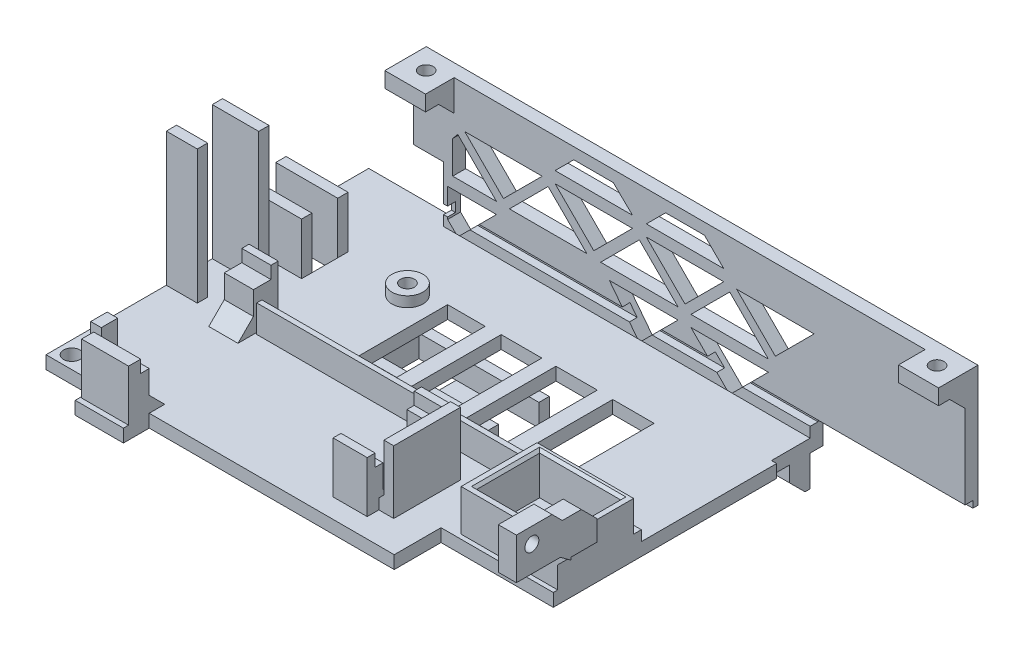
from build123d import *

# Parameters (mm, degrees)
SKETCH1_W            = 100
SKETCH1_H            = 50
BOSS_EXTRUDE1_DEPTH  = 2.5
SKETCH2_W            = 12
SKETCH2_H            = 2
SKETCH2_W_2          = 14
SKETCH2_H_2          = 2.5
BOSS_EXTRUDE2_DEPTH  = 10
SKETCH3_W            = 2
SKETCH3_H            = 15
BOSS_EXTRUDE3_DEPTH  = 9
SKETCH4_W            = 2
SKETCH4_H            = 15
BOSS_EXTRUDE4_DEPTH  = 6
SKETCH5_W            = 70.5
SKETCH5_H            = 2.5
SKETCH5_W_2          = 70.488099932
BOSS_EXTRUDE5_DEPTH  = 2
SKETCH6_W            = 70.5
SKETCH6_H            = 1
BOSS_EXTRUDE6_DEPTH  = 1.8
SKETCH7_W            = 70.488099932
SKETCH7_H            = 2.5
SKETCH7_W_2          = 70.5
BOSS_EXTRUDE7_DEPTH  = 1.5
SKETCH8_R            = 3
BOSS_EXTRUDE8_DEPTH  = 2
SKETCH9_R            = 1.35
CUT_EXTRUDE1_DEPTH   = 6.5
SKETCH10_W           = 100
SKETCH10_H           = 17.3188113
BOSS_EXTRUDE10_DEPTH = 2.5
SKETCH11_W           = 18.7
SKETCH11_H           = 16.2
SKETCH11_W_2         = 15.7
SKETCH11_H_2         = 12.2
BOSS_EXTRUDE11_DEPTH = 8
CHAMFER1_SIZE        = 0.5
SKETCH13_W           = 6
SKETCH13_H           = 2
SKETCH13_W_2         = 9
BOSS_EXTRUDE12_DEPTH = 12
SKETCH14_W           = 2
SKETCH14_H           = 2.795142651
BOSS_EXTRUDE13_DEPTH = 9
SKETCH16_W           = 9.1041359
SKETCH16_H           = 4
SKETCH16_W_2         = 5.652312223
SKETCH16_H_2         = 4.80234046
SKETCH16_W_3         = 20.476383994
SKETCH16_H_3         = 3.061420156
SKETCH16_H_4         = 2.810484078
BOSS_EXTRUDE14_DEPTH = 7.5
SKETCH17_W           = 9.1041359
SKETCH17_H           = 2.345250113
SKETCH17_W_2         = 5.652312223
SKETCH17_H_2         = 1.406462041
SKETCH17_W_3         = 20.476383994
SKETCH17_H_3         = 1.405242039
SKETCH17_H_4         = 1.530710078
BOSS_EXTRUDE15_DEPTH = 1.2
SKETCH18_W           = 20.47039794
SKETCH18_H           = 2.810451887
SKETCH18_W_2         = 20.476383994
SKETCH18_H_2         = 3.061420156
SKETCH18_W_3         = 5.652312223
SKETCH18_H_3         = 2.336151346
SKETCH18_W_4         = 9.1041359
SKETCH18_H_4         = 4
BOSS_EXTRUDE16_DEPTH = 1.2
SKETCH19_W           = 1.900158485
SKETCH19_H           = 12.912440612
BOSS_EXTRUDE17_DEPTH = 12.2
CHAMFER2_SIZE        = 3
SKETCH20_W           = 10.479569139
SKETCH20_H           = 7.910578843
SKETCH20_W_2         = 34.648374457
SKETCH20_H_2         = 2.863391661
SKETCH20_W_3         = 11.37665543
SKETCH20_H_3         = 2.773813667
SKETCH20_H_4         = 0.85940565
SKETCH20_W_4         = 11.835543615
SKETCH20_H_5         = 59.441475781
CUT_EXTRUDE2_DEPTH   = 12.2
SKETCH21_R           = 1.6
CUT_EXTRUDE3_DEPTH   = 9
SKETCH22_W           = 8
SKETCH22_H           = 4
SKETCH22_W_2         = 6
BOSS_EXTRUDE18_DEPTH = 6
CHAMFER3_SIZE        = 3
SKETCH23_R           = 1.35
CUT_EXTRUDE6_DEPTH   = 4
BOSS_EXTRUDE20_START = -1.5
SKETCH25_W           = 15.573275737
SKETCH25_H           = 7.991483458
BOSS_EXTRUDE20_DEPTH = 3.5
SKETCH26_W           = 3.5
SKETCH26_H           = 5.673275737
CUT_EXTRUDE7_DEPTH   = 2
SKETCH27_W           = 16.502676769
SKETCH27_H           = 20.487843295
CUT_EXTRUDE8_DEPTH   = 35
SKETCH28_R           = 1.35
CUT_EXTRUDE9_DEPTH   = 35
CHAMFER4_SIZE        = 3
CHAMFER5_SIZE        = 3
BOSS_EXTRUDE21_REACH = 100.643
SKETCH30_W           = 47.446580051
SKETCH30_H           = 1.27308646
CUT_EXTRUDE10_DEPTH  = 11
SKETCH31_W           = 10
SKETCH31_H           = 2.5
BOSS_EXTRUDE22_DEPTH = 29
SKETCH32_W           = 30.5
SKETCH32_H           = 26
BOSS_EXTRUDE23_DEPTH = 2.5
SKETCH33_W           = 5.852689777
SKETCH33_H           = 15.157351146
SKETCH33_W_2         = 70.5
SKETCH33_H_2         = 20.7
BOSS_EXTRUDE24_DEPTH = 2.5
SKETCH35_W           = 7.894138159
SKETCH35_H           = 5.531718611
SKETCH35_W_2         = 7.679440434
SKETCH35_H_2         = 5.136534224
SKETCH35_W_3         = 7.73858996
BOSS_EXTRUDE25_DEPTH = 3
SKETCH36_R           = 1.35
CUT_EXTRUDE12_DEPTH  = 3
SKETCH37_W           = 5
SKETCH37_H           = 4.587019784
CUT_EXTRUDE13_DEPTH  = 12
SKETCH38_W           = 7.273722909
SKETCH38_H           = 18.053706391
SKETCH38_W_2         = 7.874305534
SKETCH38_H_2         = 18.214504952
SKETCH38_W_3         = 8.00776834
SKETCH38_W_4         = 8.007768341
SKETCH38_H_3         = 18.134105671
CUT_EXTRUDE14_DEPTH  = 17
SKETCH39_W           = 22.888600216
SKETCH39_H           = 1.8
CUT_EXTRUDE15_DEPTH  = 5
SKETCH40_W           = 30
SKETCH40_H           = 5
CUT_EXTRUDE16_DEPTH  = 10
SKETCH41_W           = 31.576307645
SKETCH41_H           = 1.8
CUT_EXTRUDE17_DEPTH  = 1.5
SKETCH42_W           = 71.988099932
SKETCH42_H           = 1.5
CUT_EXTRUDE18_DEPTH  = 12
SKETCH43_W           = 6.603546664
SKETCH43_H           = 1.530710078
SKETCH43_H_2         = 1.405242039
SKETCH43_W_2         = 9.1041359
SKETCH43_H_3         = 3
SKETCH43_W_3         = 5.652312223
SKETCH43_H_4         = 3.395878419
CUT_EXTRUDE19_DEPTH  = 12
SKETCH44_W           = 9.1041359
SKETCH44_H           = 1.654749887
CUT_EXTRUDE20_DEPTH  = 22
SKETCH45_W           = 2.045887398
SKETCH45_H           = 3.1811887
BOSS_EXTRUDE26_DEPTH = 9.9
CHAMFER6_SIZE        = 1.5
CHAMFER7_SIZE        = 3
SKETCH46_W           = 14
SKETCH46_H           = 10
CUT_EXTRUDE21_DEPTH  = 5
CUT_EXTRUDE22_DEPTH  = 2.5
SKETCH48_W           = 25
SKETCH48_H           = 2
BOSS_EXTRUDE27_DEPTH = 4.3
SKETCH50_W           = 4.781011395
SKETCH50_H           = 11.6
BOSS_EXTRUDE29_DEPTH = 1.7
SKETCH51_W           = 1.951933906
SKETCH51_H           = 11.6
BOSS_EXTRUDE30_DEPTH = 4.3
SKETCH52_W           = 11.630729643
SKETCH52_H           = 8.420698883
CUT_EXTRUDE23_DEPTH  = 10


with BuildPart() as part:
    # Sketch1 → Boss-Extrude1 (new body)
    with BuildSketch(Plane(origin=(0, 0, 0), x_dir=(1, 0, 0), z_dir=(0, 1, 0))):
        with Locations((-13.167938931, 6.679389313)):
            Rectangle(SKETCH1_W, SKETCH1_H)
    extrude(amount=BOSS_EXTRUDE1_DEPTH)

    # Sketch2 → Boss-Extrude2 (add)
    with BuildSketch(Plane(origin=(0, 2.5, 0), x_dir=(1, 0, 0), z_dir=(0, 1, 0))):
        with Locations((-57.167938931, 14.679389313)):
            Rectangle(SKETCH2_W, SKETCH2_H)
        with Locations((-56.167938931, 27.929389313)):
            Rectangle(SKETCH2_W_2, SKETCH2_H_2)
        with Locations((-57.167938931, 7.679389313)):
            Rectangle(SKETCH2_W, SKETCH2_H)
    extrude(amount=BOSS_EXTRUDE2_DEPTH)

    # Sketch3 → Boss-Extrude3 (add)
    with BuildSketch(Plane.ZY.offset(63.167938931)):
        with Locations((-2.379389313, 8.674746325)):
            Rectangle(SKETCH3_W, SKETCH3_H)
    extrude(amount=-BOSS_EXTRUDE3_DEPTH)

    # Sketch4 → Boss-Extrude4 (add)
    with BuildSketch(Plane.ZY.offset(63.167938931)):
        with Locations((6.520610687, 8.856918224)):
            Rectangle(SKETCH4_W, SKETCH4_H)
    extrude(amount=-BOSS_EXTRUDE4_DEPTH)

    # Sketch5 → Boss-Extrude5 (add)
    with BuildSketch(Plane(origin=(0, 2.5, 0), x_dir=(1, 0, 0), z_dir=(0, 1, 0))):
        with Locations((-10.917938931, 30.429389313)):
            Rectangle(SKETCH5_W, SKETCH5_H)
        with Locations((-10.911988897, -5.770610687)):
            Rectangle(SKETCH5_W_2, SKETCH5_H)
    extrude(amount=BOSS_EXTRUDE5_DEPTH)

    # Sketch6 → Boss-Extrude6 (add)
    with BuildSketch(Plane(origin=(0, 4.5, 0), x_dir=(1, 0, 0), z_dir=(0, 1, 0))):
        with Locations((-10.917938931, 31.179389313)):
            Rectangle(SKETCH6_W, SKETCH6_H)
        with Locations((-10.917938931, -6.520610687)):
            Rectangle(SKETCH6_W, SKETCH6_H)
    extrude(amount=BOSS_EXTRUDE6_DEPTH)

    # Sketch7 → Boss-Extrude7 (add)
    with BuildSketch(Plane(origin=(0, 6.3, 0), x_dir=(1, 0, 0), z_dir=(0, 1, 0))):
        with Locations((-10.911988897, -5.770610687)):
            Rectangle(SKETCH7_W, SKETCH7_H)
        with Locations((-10.917938931, 30.429389313)):
            Rectangle(SKETCH7_W_2, SKETCH7_H)
    extrude(amount=BOSS_EXTRUDE7_DEPTH)

    # Sketch8 → Boss-Extrude8 (add)
    with BuildSketch(Plane(origin=(0, 2.5, 0), x_dir=(1, 0, 0), z_dir=(0, 1, 0))):
        with Locations(Location((-38.167938931, 14.179389313, 0), (0, 0, 270))):
            Circle(SKETCH8_R)
    extrude(amount=BOSS_EXTRUDE8_DEPTH)

    # Sketch9 → Cut-Extrude1 (cut)
    with BuildSketch(Plane(origin=(0, 4.5, 0), x_dir=(1, 0, 0), z_dir=(0, 1, 0))):
        with Locations(Location((-38.167938931, 14.179389313, 0), (0, 0, 270))):
            Circle(SKETCH9_R)
    extrude(amount=-CUT_EXTRUDE1_DEPTH, mode=Mode.SUBTRACT)

    # Sketch10 → Boss-Extrude10 (add)
    with BuildSketch(Plane(origin=(0, 2.5, 0), x_dir=(1, 0, 0), z_dir=(0, 1, 0))):
        with Locations((-13.167938931, -26.980016337)):
            Rectangle(SKETCH10_W, SKETCH10_H)
    extrude(amount=-BOSS_EXTRUDE10_DEPTH)

    # Sketch11 → Boss-Extrude11 (add)
    with BuildSketch(Plane(origin=(0, 2.5, 0), x_dir=(1, 0, 0), z_dir=(0, 1, 0))):
        with Locations((16.482061069, -12.620610687)):
            Rectangle(SKETCH11_W, SKETCH11_H)
        with Locations((16.482061069, -13.120610687)):
            Rectangle(SKETCH11_W_2, SKETCH11_H_2, mode=Mode.SUBTRACT)
    extrude(amount=BOSS_EXTRUDE11_DEPTH)

    # Chamfer1
    chamfer1_edges = [part.edges().sort_by_distance(p)[0] for p in [
        (8.632061069, 10.5, 13.120610687),
        (16.482061069, 10.5, 19.220610687),
        (24.332061069, 10.5, 13.120610687),
        (16.482061069, 10.5, 7.020610687),
    ]]
    chamfer(chamfer1_edges, length=CHAMFER1_SIZE)

    # Sketch13 → Boss-Extrude12 (add)
    with BuildSketch(Plane(origin=(0, 16.356918224, 0), x_dir=(1, 0, 0), z_dir=(0, 1, 0))):
        with Locations((-60.167938931, -6.520610687)):
            Rectangle(SKETCH13_W, SKETCH13_H)
        with Locations((-58.667938931, 2.379389313)):
            Rectangle(SKETCH13_W_2, SKETCH13_H)
    extrude(amount=BOSS_EXTRUDE12_DEPTH)


with BuildPart() as boss_extrude12_piece_1:
    # of the separate pieces the step leaves, piece 1, a body of its own (boss_extrude12_pieces)
    add(part.part.solids().sort_by_distance((8.132061069, 10.5, 19.720610687))[0])



with BuildPart() as boss_extrude12_piece_2:
    # of the separate pieces the step leaves, piece 2, a body of its own (boss_extrude12_pieces)
    add(part.part.solids().sort_by_distance((-63.167938931, 16.356918224, -3.379389313))[0])


with BuildPart() as boss_extrude12_piece_1_1:
    add(boss_extrude12_piece_1.part)

    add(boss_extrude12_piece_2.part)  # Boss-Extrude13 merges Boss-Extrude12 piece 2
    # Sketch14 → Boss-Extrude13 (add)
    with BuildSketch(Plane.ZY.offset(63.167938931)):
        with Locations((-2.379389313, 16.557730514)):
            Rectangle(SKETCH14_W, SKETCH14_H)
    extrude(amount=-BOSS_EXTRUDE13_DEPTH)

    # Sketch16 → Boss-Extrude14 (add)
    with BuildSketch(Plane(origin=(0, 2.5, 0), x_dir=(1, 0, 0), z_dir=(0, 1, 0))):
        with Locations((-47.90773498, -32.639421987)):
            Rectangle(SKETCH16_W, SKETCH16_H)
        with Locations((-49.316086437, -4.921780917)):
            Rectangle(SKETCH16_W_2, SKETCH16_H_2)
        with Locations((-15.148804269, -25.341936571)):
            Rectangle(SKETCH16_W_3, SKETCH16_H_3)
        with Locations((-15.148804269, -11.164048144)):
            Rectangle(SKETCH16_W_3, SKETCH16_H_4)
    extrude(amount=BOSS_EXTRUDE14_DEPTH)

    # Sketch17 → Boss-Extrude15 (add)
    with BuildSketch(Plane(origin=(0, 10, 0), x_dir=(1, 0, 0), z_dir=(0, 1, 0))):
        with Locations((-47.90773498, -33.46679693)):
            Rectangle(SKETCH17_W, SKETCH17_H)
        with Locations((-49.316086437, -3.223841708)):
            Rectangle(SKETCH17_W_2, SKETCH17_H_2)
        with Locations((-15.148804269, -10.461427125)):
            Rectangle(SKETCH17_W_3, SKETCH17_H_3)
        with Locations((-15.148804269, -26.10729161)):
            Rectangle(SKETCH17_W_3, SKETCH17_H_4)
    extrude(amount=BOSS_EXTRUDE15_DEPTH)

    # Sketch18 → Boss-Extrude16 (add)
    with BuildSketch(Plane(origin=(0, 11.2, 0), x_dir=(1, 0, 0), z_dir=(0, 1, 0))):
        with Locations((-15.145811242, -11.16406424)):
            Rectangle(SKETCH18_W, SKETCH18_H)
        with Locations((-15.148804269, -25.341936571)):
            Rectangle(SKETCH18_W_2, SKETCH18_H_2)
        with Locations((-49.316086437, -3.68868636)):
            Rectangle(SKETCH18_W_3, SKETCH18_H_3)
        with Locations((-47.90773498, -32.639421987)):
            Rectangle(SKETCH18_W_4, SKETCH18_H_4)
    extrude(amount=BOSS_EXTRUDE16_DEPTH)

    # Sketch19 → Boss-Extrude17 (add)
    with BuildSketch(Plane(origin=(0, 2.5, 0), x_dir=(1, 0, 0), z_dir=(0, 1, 0))):
        with Locations((-2.968714348, -18.165139419)):
            Rectangle(SKETCH19_W, SKETCH19_H)
    extrude(amount=BOSS_EXTRUDE17_DEPTH)

    # Chamfer2
    # the kernel refuses this chamfer: 3 mm, written as the material it adds along each edge
    with BuildSketch(Plane(origin=(-52.45980293, 2.5, 30.639421987), x_dir=(0, -0.027495876610586334, -0.9996219169112968), z_dir=(1, 0, 0))) as chamfer2_piece_1:
        Polygon((CHAMFER2_SIZE * 0.999621916911, CHAMFER2_SIZE * 0.0274958766106), (-CHAMFER2_SIZE * 0.0274958766106, CHAMFER2_SIZE * 0.999621916911), (0, 0), align=None)
    extrude(amount=9.1041359)
    with BuildSketch(Plane(origin=(-46.489930325, 2.5, 7.322951147), x_dir=(0, -0.027495876610586334, 0.9996219169112968), z_dir=(-1, 0, 0))) as chamfer2_piece_2:
        Polygon((CHAMFER2_SIZE * 0.999621916911, CHAMFER2_SIZE * 0.0274958766106), (-CHAMFER2_SIZE * 0.0274958766106, CHAMFER2_SIZE * 0.999621916911), (0, 0), align=None)
    extrude(amount=5.652312223)
    with BuildSketch(Plane(origin=(-4.910612272, 2.5, 23.811226493), x_dir=(0, -0.027495876610586334, -0.9996219169112968), z_dir=(-1, 0, 0))) as chamfer2_piece_3:
        Polygon((CHAMFER2_SIZE * 0.999621916911, -CHAMFER2_SIZE * 0.0274958766106), (-CHAMFER2_SIZE * 0.0274958766106, -CHAMFER2_SIZE * 0.999621916911), (0, 0), align=None)
    extrude(amount=20.476383994)
    with BuildSketch(Plane(origin=(-4.910612272, 2.5, 12.569290183), x_dir=(0, -0.02749587661058635, 0.9996219169112968), z_dir=(-1, 0, 0))) as chamfer2_piece_4:
        Polygon((CHAMFER2_SIZE * 0.999621916911, CHAMFER2_SIZE * 0.0274958766106), (-CHAMFER2_SIZE * 0.0274958766106, CHAMFER2_SIZE * 0.999621916911), (0, 0), align=None)
    extrude(amount=20.476383994)
    with BuildSketch(Plane(origin=(-3.91879359, 2.5, 24.621359725), x_dir=(-0.9996219169112968, -0.027495876610586348, 0), z_dir=(0, 0, -1))) as chamfer2_piece_5:
        Polygon((CHAMFER2_SIZE * 0.999621916911, CHAMFER2_SIZE * 0.0274958766106), (-CHAMFER2_SIZE * 0.0274958766106, CHAMFER2_SIZE * 0.999621916911), (0, 0), align=None)
    extrude(amount=12.912440612)

    # Sketch20 → Cut-Extrude2 (cut)
    with BuildSketch(Plane(origin=(0, 2.5, 0), x_dir=(1, 0, 0), z_dir=(0, 1, 0))):
        with Locations((-57.928154362, -34.775900109)):
            Rectangle(SKETCH20_W, SKETCH20_H)
        Polygon((4.090913021, -31.912508447), (-43.35566703, -31.912508447), (-43.35566703, -38.73118953), (38.739287478, -38.73118953), (38.739287478, -34.775900108), (4.090913021, -34.775900108), align=None)
        Polygon((4.090913021, -21.580016337), (4.090913021, -31.912508447), (38.739287478, -31.912508447), (38.739287478, -21.580016337), (37.208716499, -21.580016337), (37.208716499, -24.353830004), (25.832061069, -24.353830004), (25.832061069, -21.580016337), align=None)
        with Locations((21.41510025, -33.344204277)):
            Rectangle(SKETCH20_W_2, SKETCH20_H_2)
        with Locations((31.520388784, -22.966923171)):
            Rectangle(SKETCH20_W_3, SKETCH20_H_3)
        with Locations((31.520388784, -21.150313512)):
            Rectangle(SKETCH20_W_3, SKETCH20_H_4)
        with Locations((31.749832877, 9.000127204)):
            Rectangle(SKETCH20_W_4, SKETCH20_H_5)
    extrude(amount=-CUT_EXTRUDE2_DEPTH, mode=Mode.SUBTRACT)

    # Sketch21 → Cut-Extrude3 (cut)
    with BuildSketch(Plane(origin=(0, 2.5, 0), x_dir=(1, 0, 0), z_dir=(0, 1, 0))):
        with Locations(Location((-60.667938931, -28.320610687, 0), (0, 0, 270))):
            Circle(SKETCH21_R)
    extrude(amount=-CUT_EXTRUDE3_DEPTH, mode=Mode.SUBTRACT)

    # Sketch22 → Boss-Extrude18 (add)
    with BuildSketch(Plane.XZ):
        with Locations((-59.167938931, -27.179389313)):
            Rectangle(SKETCH22_W, SKETCH22_H)
        with Locations((-18.167938931, -27.179389313)):
            Rectangle(SKETCH22_W_2, SKETCH22_H)
        with Locations((20.832061069, -27.179389313)):
            Rectangle(SKETCH22_W, SKETCH22_H)
    extrude(amount=BOSS_EXTRUDE18_DEPTH)

    # Chamfer3
    chamfer3_edges = [boss_extrude12_piece_1_1.edges().sort_by_distance(p)[0] for p in [
        (-59.167938931, -6, -25.179389313),
        (-18.167938931, -6, -25.179389313),
        (20.832061069, -6, -25.179389313),
    ]]
    chamfer(chamfer3_edges, length=CHAMFER3_SIZE)

    # Sketch23 → Cut-Extrude6 (cut)
    with BuildSketch(Plane(origin=(0, 0, -29.179389313), x_dir=(-1, 0, 0), z_dir=(0, 0, -1))):
        with Locations((59.167938931, -3)):
            Circle(SKETCH23_R)
        with Locations((18.167938931, -3)):
            Circle(SKETCH23_R)
        with Locations((-20.832061069, -3)):
            Circle(SKETCH23_R)
    extrude(amount=-CUT_EXTRUDE6_DEPTH, mode=Mode.SUBTRACT)

    # Sketch25 → Boss-Extrude20 (add)
    with BuildSketch(Plane(origin=(25.832061069, 0, 0), x_dir=(0, 0, -1), z_dir=(1, 0, 0)).offset(BOSS_EXTRUDE20_START)):
        with Locations((-22.933972819, 13.704258271)):
            Rectangle(SKETCH25_W, SKETCH25_H)
    extrude(amount=BOSS_EXTRUDE20_DEPTH)

    # Sketch26 → Cut-Extrude7 (cut)
    with BuildSketch(Plane(origin=(0, 17.7, 0), x_dir=(1, 0, 0), z_dir=(0, 1, 0))):
        with Locations((26.082061069, -17.983972818)):
            Rectangle(SKETCH26_W, SKETCH26_H)
    extrude(amount=-CUT_EXTRUDE7_DEPTH, mode=Mode.SUBTRACT)

    # Sketch27 → Cut-Extrude8 (cut)
    with BuildSketch(Plane(origin=(0, 2.5, 0), x_dir=(1, 0, 0), z_dir=(0, 1, 0))):
        with Locations((-19.765497321, -18.129970715)):
            Rectangle(SKETCH27_W, SKETCH27_H)
    extrude(amount=CUT_EXTRUDE8_DEPTH, mode=Mode.SUBTRACT)

    # Sketch28 → Cut-Extrude9 (cut)
    with BuildSketch(Plane.ZY.offset(-24.332061069)):
        with Locations((27.720610687, 14.7)):
            Circle(SKETCH28_R)
    extrude(amount=-CUT_EXTRUDE9_DEPTH, mode=Mode.SUBTRACT)

    # Chamfer4
    # the kernel refuses this chamfer: 3 mm, written as the material it adds along each edge
    with BuildSketch(Plane(origin=(25.832061069, 9.708516542, 15.14733495), x_dir=(-0.027495876610586775, -0.9996219169112968, 0), z_dir=(0, 0, 1))) as chamfer4_piece_1_section:
        Polygon((CHAMFER4_SIZE * 0.999621916911, CHAMFER4_SIZE * 0.0274958766106), (-CHAMFER4_SIZE * 0.0274958766106, CHAMFER4_SIZE * 0.999621916911), (0, 0), align=None)
    chamfer4_piece_1 = extrude(amount=5.573275737, mode=Mode.PRIVATE)
    chamfer4_piece_1 = split(chamfer4_piece_1, bisect_by=Plane(origin=(27.832061069, 8.616425537, 17.933972818), z_dir=(-1, 0, 0)), keep=Keep.TOP, mode=Mode.PRIVATE)
    add(chamfer4_piece_1)

    # Chamfer5
    # the kernel refuses this chamfer: 3 mm, written as the material it takes off along each edge
    with BuildSketch(Plane(origin=(16.617012105, 15.7, 15.14733495), x_dir=(0, 0.02749587661058619, 0.9996219169112968), z_dir=(1, 0, 0))) as chamfer5_piece_1:
        Polygon((CHAMFER5_SIZE * 0.999621916911, CHAMFER5_SIZE * 0.0274958766106), (-CHAMFER5_SIZE * 0.0274958766106, CHAMFER5_SIZE * 0.999621916911), (0, 0), align=None)
    extrude(amount=18.930097928, mode=Mode.SUBTRACT)
    with BuildSketch(Plane(origin=(35.547110033, 17.7, 20.820610687), x_dir=(0, 0.027495876610585616, 0.9996219169112968), z_dir=(-1, 0, 0))) as chamfer5_piece_2_section:
        Polygon((CHAMFER5_SIZE * 0.999621916911, -CHAMFER5_SIZE * 0.0274958766106), (-CHAMFER5_SIZE * 0.0274958766106, -CHAMFER5_SIZE * 0.999621916911), (0, 0), align=None)
    chamfer5_piece_2 = extrude(amount=18.930097928, mode=Mode.PRIVATE)
    chamfer5_piece_2 = split(chamfer5_piece_2, bisect_by=Plane(origin=(26.082061069, 15.7, 21.912701692), z_dir=(0, 1, 0)), keep=Keep.TOP, mode=Mode.PRIVATE)
    add(chamfer5_piece_2, mode=Mode.SUBTRACT)

    # Boss-Extrude21: up to this face of the body (flat: up to its plane)
    boss_extrude21_end = Plane(boss_extrude12_piece_1_1.part.faces().sort_by_distance((27.832061069, 12.920387826, 23.274339252))[0])
    # Sketch29 → Boss-Extrude21 (add, up to the picked face)
    with BuildSketch(Plane.ZY.offset(-24.332061069), mode=Mode.PRIVATE) as boss_extrude21_sk1:
        Polygon((22.985991446, 10.283101312), (20.175687802, 8.22137336), (20.175687802, 10.619316914), (23.242398743, 10.619316914), align=None)
    boss_extrude21_tool1 = split(extrude(boss_extrude21_sk1.sketch, amount=-BOSS_EXTRUDE21_REACH, mode=Mode.PRIVATE), bisect_by=boss_extrude21_end, keep=Keep.BOTH, mode=Mode.PRIVATE)
    add(boss_extrude21_tool1.solids().sort_by(Axis((24.332061, 9.813999, 21.248106), (1, 0, 0)))[0])

    # Sketch30 → Cut-Extrude10 (cut)
    with BuildSketch(Plane(origin=(0, 2.5, 0), x_dir=(1, 0, 0), z_dir=(0, 1, 0))):
        with Locations((-19.632377005, -31.275965217)):
            Rectangle(SKETCH30_W, SKETCH30_H)
    extrude(amount=-CUT_EXTRUDE10_DEPTH, mode=Mode.SUBTRACT)

    # Sketch31 → Boss-Extrude22 (add)
    with BuildSketch(Plane(origin=(25.832061069, 0, 0), x_dir=(0, 0, -1), z_dir=(1, 0, 0))):
        with Locations((26.679389313, 1.25)):
            Rectangle(SKETCH31_W, SKETCH31_H)
    extrude(amount=BOSS_EXTRUDE22_DEPTH)

    # Sketch32 → Boss-Extrude23 (add)
    with BuildSketch(Plane(origin=(0, 0, -31.679389313), x_dir=(-1, 0, 0), z_dir=(0, 0, -1))):
        with Locations((-39.582061069, 15.5)):
            Rectangle(SKETCH32_W, SKETCH32_H)
    extrude(amount=-BOSS_EXTRUDE23_DEPTH)

    # Sketch33 → Boss-Extrude24 (add)
    with BuildSketch(Plane(origin=(0, 0, -31.679389313), x_dir=(-1, 0, 0), z_dir=(0, 0, -1))):
        with Locations((49.09428382, 20.921324427)):
            Rectangle(SKETCH33_W, SKETCH33_H)
        with Locations((10.917938931, 18.15)):
            Rectangle(SKETCH33_W_2, SKETCH33_H_2)
    extrude(amount=-BOSS_EXTRUDE24_DEPTH)

    # Sketch35 → Boss-Extrude25 (add)
    with BuildSketch(Plane(origin=(0, 28.5, 0), x_dir=(1, 0, 0), z_dir=(0, 1, 0))):
        with Locations((-48.073559629, 26.413530008)):
            Rectangle(SKETCH35_W, SKETCH35_H)
        with Locations((16.954823751, 26.611122201)):
            Rectangle(SKETCH35_W_2, SKETCH35_H_2)
        with Locations((50.962766089, 26.611122201)):
            Rectangle(SKETCH35_W_3, SKETCH35_H_2)
    extrude(amount=-BOSS_EXTRUDE25_DEPTH)

    # Sketch36 → Cut-Extrude12 (cut)
    with BuildSketch(Plane(origin=(0, 28.5, 0), x_dir=(1, 0, 0), z_dir=(0, 1, 0))):
        with Locations(Location((-48.03294763, 27.668019801, 0), (0, 0, 270))):
            Circle(SKETCH36_R)
        with Locations(Location((50.908321213, 27.668019801, 0), (0, 0, 270))):
            Circle(SKETCH36_R)
    extrude(amount=-CUT_EXTRUDE12_DEPTH, mode=Mode.SUBTRACT)

    # Sketch37 → Cut-Extrude13 (cut)
    with BuildSketch(Plane.ZY.offset(63.167938931)):
        with Locations((-11.179389313, 0.206490108)):
            Rectangle(SKETCH37_W, SKETCH37_H)
    extrude(amount=-CUT_EXTRUDE13_DEPTH, mode=Mode.SUBTRACT)

    # Sketch38 → Cut-Extrude14 (cut)
    with BuildSketch(Plane(origin=(0, 2.5, 0), x_dir=(1, 0, 0), z_dir=(0, 1, 0))):
        with Locations((-29.040588975, 7.443845115)):
            Rectangle(SKETCH38_W, SKETCH38_H)
        with Locations((-18.530393028, 7.524244396)):
            Rectangle(SKETCH38_W_2, SKETCH38_H_2)
        with Locations((-7.853368574, 7.524244396)):
            Rectangle(SKETCH38_W_3, SKETCH38_H_2)
        with Locations((3.224044297, 7.484044756)):
            Rectangle(SKETCH38_W_4, SKETCH38_H_3)
    extrude(amount=-CUT_EXTRUDE14_DEPTH, mode=Mode.SUBTRACT)

    # Sketch39 → Cut-Extrude15 (cut)
    with BuildSketch(Plane(origin=(0, 0, 6.020610687), x_dir=(-1, 0, 0), z_dir=(0, 0, -1))):
        with Locations((-17.129456342, 5.4)):
            Rectangle(SKETCH39_W, SKETCH39_H)
    extrude(amount=CUT_EXTRUDE15_DEPTH, mode=Mode.SUBTRACT)

    # Sketch40 → Cut-Extrude16 (cut)
    with BuildSketch(Plane(origin=(0, 0, -31.679389313), x_dir=(-1, 0, 0), z_dir=(0, 0, -1))):
        with Locations((-39.832061069, 2.5)):
            Rectangle(SKETCH40_W, SKETCH40_H)
    extrude(amount=-CUT_EXTRUDE16_DEPTH, mode=Mode.SUBTRACT)

    # Sketch41 → Cut-Extrude17 (cut)
    with BuildSketch(Plane.XY.offset(-29.179389313)):
        with Locations((40.120214892, 5.4)):
            Rectangle(SKETCH41_W, SKETCH41_H)
    extrude(amount=-CUT_EXTRUDE17_DEPTH, mode=Mode.SUBTRACT)

    # Sketch42 → Cut-Extrude18 (cut)
    with BuildSketch(Plane(origin=(0, 4.5, 0), x_dir=(1, 0, 0), z_dir=(0, 1, 0))):
        with Locations((-10.161988897, -5.270610687)):
            Rectangle(SKETCH42_W, SKETCH42_H)
    extrude(amount=CUT_EXTRUDE18_DEPTH, mode=Mode.SUBTRACT)

    # Sketch43 → Cut-Extrude19 (cut)
    with BuildSketch(Plane(origin=(0, 10, 0), x_dir=(1, 0, 0), z_dir=(0, 1, 0))):
        with Locations((-8.212385604, -24.576581532)):
            Rectangle(SKETCH43_W, SKETCH43_H)
        with Locations((-8.212385604, -11.866669164)):
            Rectangle(SKETCH43_W, SKETCH43_H_2)
        with Locations((-47.90773498, -29.139421987)):
            Rectangle(SKETCH43_W_2, SKETCH43_H_3)
        with Locations((-49.316086437, -5.625011938)):
            Rectangle(SKETCH43_W_3, SKETCH43_H_4)
    extrude(amount=CUT_EXTRUDE19_DEPTH, mode=Mode.SUBTRACT)

    # Sketch44 → Cut-Extrude20 (cut)
    with BuildSketch(Plane(origin=(0, 10, 0), x_dir=(1, 0, 0), z_dir=(0, 1, 0))):
        with Locations((-47.90773498, -31.466796931)):
            Rectangle(SKETCH44_W, SKETCH44_H)
    extrude(amount=CUT_EXTRUDE20_DEPTH, mode=Mode.SUBTRACT)

    # Sketch45 → Boss-Extrude26 (add)
    with BuildSketch(Plane(origin=(0, 2.5, 0), x_dir=(1, 0, 0), z_dir=(0, 1, 0))):
        with Locations((-53.482746629, -29.230016337)):
            Rectangle(SKETCH45_W, SKETCH45_H)
    extrude(amount=BOSS_EXTRUDE26_DEPTH)

    # Chamfer6
    # the kernel refuses this chamfer: 1.5 mm, written as the material it adds along each edge
    with BuildSketch(Plane(origin=(-52.45980293, -1.357524482, 30.820610687), x_dir=(-0.9996219169112965, 0, -0.02749587661058676), z_dir=(0, 1, 0))) as chamfer6_piece_1_section:
        Polygon((CHAMFER6_SIZE * 0.999621916911, CHAMFER6_SIZE * 0.0274958766106), (-CHAMFER6_SIZE * 0.0274958766106, CHAMFER6_SIZE * 0.999621916911), (0, 0), align=None)
    chamfer6_piece_1 = extrude(amount=11.357524482, mode=Mode.PRIVATE)
    chamfer6_piece_1 = split(chamfer6_piece_1, bisect_by=Plane(origin=(-53.112180838, 0, 31.244421733), z_dir=(0, 1, 0)), keep=Keep.TOP, mode=Mode.PRIVATE)
    add(chamfer6_piece_1)
    with BuildSketch(Plane(origin=(-52.45980293, -1.357524482, 30.820610687), x_dir=(-0.9996219169112965, 0, -0.02749587661058676), z_dir=(0, 1, 0))) as chamfer6_piece_2_section:
        Polygon((CHAMFER6_SIZE * 0.999621916911, CHAMFER6_SIZE * 0.0274958766106), (-CHAMFER6_SIZE * 0.0274958766106, CHAMFER6_SIZE * 0.999621916911), (0, 0), align=None)
    chamfer6_piece_2 = extrude(amount=15.215048964, mode=Mode.PRIVATE)
    chamfer6_piece_2 = split(chamfer6_piece_2, bisect_by=Plane(origin=(-52.468615868, 12.4, 32.302984811), z_dir=(0, -1, 0)), keep=Keep.TOP, mode=Mode.PRIVATE)
    chamfer6_piece_2 = split(chamfer6_piece_2, bisect_by=Plane(origin=(-52.468615868, 11.2, 32.294171874), z_dir=(0, 0, 1)), keep=Keep.TOP, mode=Mode.PRIVATE)
    chamfer6_piece_2 = split(chamfer6_piece_2, bisect_by=Plane(origin=(-52.468615868, 10, 32.302984811), z_dir=(0, 1, 0)), keep=Keep.TOP, mode=Mode.PRIVATE)
    add(chamfer6_piece_2)

    # Chamfer7
    # the kernel refuses this chamfer: 3 mm, written as the material it adds along each edge
    with BuildSketch(Plane(origin=(-52.020628708, 25.5, -29.179389313), x_dir=(0, 0.027495876610586768, 0.9996219169112968), z_dir=(1, 0, 0))) as chamfer7_piece_1_section:
        Polygon((CHAMFER7_SIZE * 0.999621916911, CHAMFER7_SIZE * 0.0274958766106), (-CHAMFER7_SIZE * 0.0274958766106, CHAMFER7_SIZE * 0.999621916911), (0, 0), align=None)
    chamfer7_piece_1 = extrude(amount=7.894138158, mode=Mode.PRIVATE)
    chamfer7_piece_1 = chamfer7_piece_1 - Plane(origin=(-48.03294763, 25.078584661, -27.668019801), x_dir=(0, 0, 1), z_dir=(0, 1, 0)) * Cylinder(1.35, 28, mode=Mode.PRIVATE)
    add(chamfer7_piece_1)
    with BuildSketch(Plane(origin=(13.115103534, 25.5, -29.179389313), x_dir=(0, 0.027495876610586768, 0.9996219169112968), z_dir=(1, 0, 0))) as chamfer7_piece_2:
        Polygon((CHAMFER7_SIZE * 0.999621916911, CHAMFER7_SIZE * 0.0274958766106), (-CHAMFER7_SIZE * 0.0274958766106, CHAMFER7_SIZE * 0.999621916911), (0, 0), align=None)
    extrude(amount=7.679440433)
    with BuildSketch(Plane(origin=(47.093471109, 25.5, -29.179389313), x_dir=(0, 0.027495876610586768, 0.9996219169112968), z_dir=(1, 0, 0))) as chamfer7_piece_3_section:
        Polygon((CHAMFER7_SIZE * 0.999621916911, CHAMFER7_SIZE * 0.0274958766106), (-CHAMFER7_SIZE * 0.0274958766106, CHAMFER7_SIZE * 0.999621916911), (0, 0), align=None)
    chamfer7_piece_3 = extrude(amount=7.73858996, mode=Mode.PRIVATE)
    chamfer7_piece_3 = chamfer7_piece_3 - Plane(origin=(50.908321213, 25.078395761, -27.668019801), x_dir=(0, 0, 1), z_dir=(0, 1, 0)) * Cylinder(1.35, 28, mode=Mode.PRIVATE)
    add(chamfer7_piece_3)

    # Sketch46 → Cut-Extrude21 (cut)
    with BuildSketch(Plane(origin=(0, 0, -29.179389313), x_dir=(-1, 0, 0), z_dir=(0, 0, -1))):
        with Locations((56.167938931, 7.5)):
            Rectangle(SKETCH46_W, SKETCH46_H)
    extrude(amount=-CUT_EXTRUDE21_DEPTH, mode=Mode.SUBTRACT)

    # Sketch47 → Cut-Extrude22 (cut)
    with BuildSketch(Plane(origin=(0, 0, -31.679389313), x_dir=(-1, 0, 0), z_dir=(0, 0, -1))):
        Polygon((42.072095151, 20.483453196), (34.572095151, 12.983453196), (27.072095151, 20.483453196), align=None)
        Polygon((43.425292563, 19.331619344), (35.925292563, 11.831619344), (44.402782978, 11.831619344), (44.402782978, 18.152765368), align=None)
        Polygon((45.423929002, 9.631619344), (35.925292563, 9.631619344), (43.425292563, 2.131619344), (45.380273393, 4.086600174), align=None)
        Polygon((25.925292563, 19.331619344), (18.425292563, 11.831619344), (33.425292563, 11.831619344), align=None)
        Polygon((24.572095151, 20.483453196), (17.072095151, 12.983453196), (9.572095151, 20.483453196), align=None)
        Polygon((13.301248102, 26.3), (9.572095151, 22.683453196), (24.572095151, 22.683453196), (20.955548346, 26.3), align=None)
        Polygon((8.260282067, 19.218669241), (0.760282067, 11.718669241), (15.760282067, 11.718669241), align=None)
        Polygon((0.760282067, 9.518669241), (8.260282067, 2.018669241), (14.059251139, 9.518669241), align=None)
        Polygon((-16.739717933, 9.518669241), (-1.739717933, 9.518669241), (-9.239717933, 2.018669241), align=None)
        Polygon((-9.239717933, 19.218669241), (-16.739717933, 11.718669241), (-1.739717933, 11.718669241), align=None)
        Polygon((6.907084655, 20.370503092), (-8.092915345, 20.370503092), (-0.592915345, 12.870503092), align=None)
        Polygon((-10.592915345, 20.370503092), (-25.592915345, 20.370503092), (-18.092915345, 12.870503092), align=None)
        Polygon((-4.363418438, 26.3), (-8.092915345, 22.570503092), (6.907084655, 22.570503092), (3.177587747, 26.3), align=None)
    extrude(amount=-CUT_EXTRUDE22_DEPTH, mode=Mode.SUBTRACT)

    # Sketch48 → Boss-Extrude27 (add)
    with BuildSketch(Plane.XZ):
        with Locations((-22.65912153, -2.81699192)):
            Rectangle(SKETCH48_W, SKETCH48_H)
        with Locations((-22.437573272, -12.41699192)):
            Rectangle(SKETCH48_W, SKETCH48_H)
    extrude(amount=BOSS_EXTRUDE27_DEPTH)

    # Sketch50 → Boss-Extrude29 (add)
    with BuildSketch(Plane.XZ.offset(4.3)):
        with Locations((-23.566226522, -7.61699192)):
            Rectangle(SKETCH50_W, SKETCH50_H)
    extrude(amount=BOSS_EXTRUDE29_DEPTH)

    # Sketch51 → Boss-Extrude30 (add)
    with BuildSketch(Plane.XZ.offset(4.3)):
        with Locations((-34.183154577, -7.61699192)):
            Rectangle(SKETCH51_W, SKETCH51_H)
    extrude(amount=-BOSS_EXTRUDE30_DEPTH)

    # Sketch52 → Cut-Extrude23 (cut)
    with BuildSketch(Plane(origin=(0, 28.5, 0), x_dir=(1, 0, 0), z_dir=(0, 1, 0))):
        with Locations((17.529442343, 24.969039872)):
            Rectangle(SKETCH52_W, SKETCH52_H)
    extrude(amount=-CUT_EXTRUDE23_DEPTH, mode=Mode.SUBTRACT)


solid = boss_extrude12_piece_1_1.part
